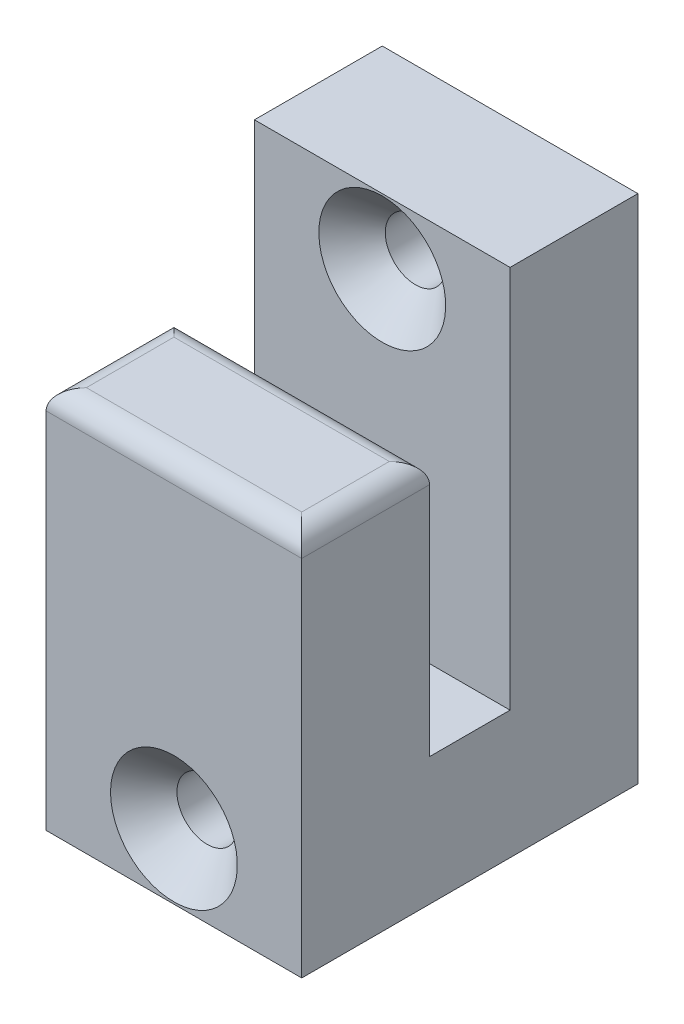
from build123d import *

# Parameters (mm, degrees)
BOSS_EXTRUDE1_DEPTH = 25.4
SKETCH2_R           = 3
CUT_EXTRUDE1_DEPTH  = 52.023307999
CHAMFER1_SIZE       = 3.3
FILLET1_R           = 2


with BuildPart() as part:
    # Sketch1 → Boss-Extrude1 (new body)
    with BuildSketch(Plane(origin=(0, 0, 0), x_dir=(0, 0, -1), z_dir=(1, 0, 0))):
        Polygon((-1.614285714, 16.328571429), (-14.314285714, 16.328571429), (-14.314285714, -21.771428571), (19.085714286, -21.771428571), (19.085714286, 29.028571429), (6.385714286, 29.028571429), (6.385714286, -9.071428571), (-1.614285714, -9.071428571), align=None)
    extrude(amount=BOSS_EXTRUDE1_DEPTH)

    # Sketch2 → Cut-Extrude1 (cut, through all)
    with BuildSketch(Plane(origin=(0, 0, -19.085714286), x_dir=(-1, 0, 0), z_dir=(0, 0, -1))):
        with Locations((-12.7, 22.528571429)):
            Circle(SKETCH2_R)
        with Locations((-12.7, -15.271428571)):
            Circle(SKETCH2_R)
    extrude(amount=-CUT_EXTRUDE1_DEPTH, mode=Mode.SUBTRACT)

    # Chamfer1
    chamfer1_edges = [part.edges().sort_by_distance(p)[0] for p in [
        (15.7, -15.271428571, 14.314285714),
        (15.7, 22.528571429, -6.385714286),
    ]]
    chamfer(chamfer1_edges, length=CHAMFER1_SIZE)

    # Fillet1
    fillet1_edges = [part.edges().sort_by_distance(p)[0] for p in [
        (12.7, 16.328571429, 1.614285714),
        (25.4, 16.328571429, 7.964285714),
        (12.7, 16.328571429, 14.314285714),
        (0, 16.328571429, 7.964285714),
    ]]
    fillet(fillet1_edges, radius=FILLET1_R)


solid = part.part
